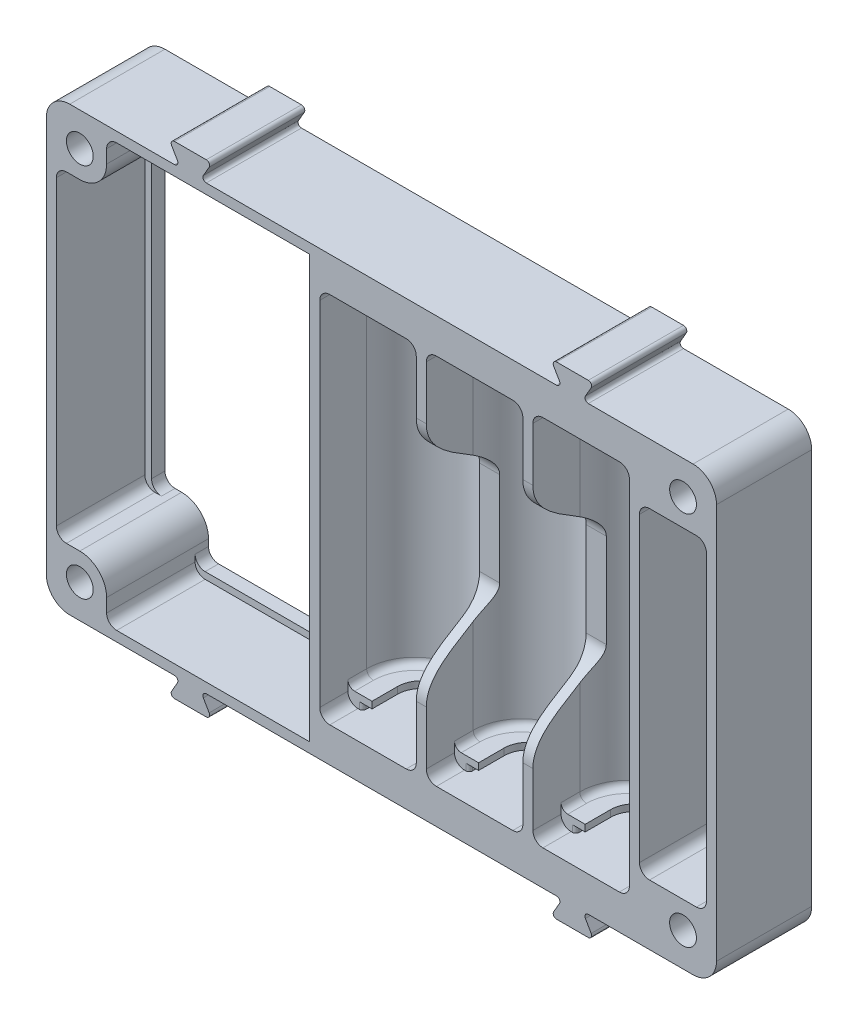
from build123d import *

# Parameters (mm, degrees)
BOSS_EXTRUDE1_DEPTH     = 27.8
SKETCH2_W               = 49.2
SKETCH2_H               = 15.2
BOSS_EXTRUDE2_DEPTH     = 1.5
CUT_EXTRUDE2_DEPTH      = 15
CUT_EXTRUDE2_DEPTH_BACK = 15
INNER_DEPTH             = 1
BOSS_EXTRUDE4_DEPTH     = 1
SKETCH5_W               = 3.4
SKETCH5_H               = 0.5
CUT_EXTRUDE1_DEPTH      = 42.166612686
SKETCH10_W              = 3.4
SKETCH10_H              = 2
CUT_EXTRUDE6_DEPTH      = 0.6
FILLET2_R               = 1.5
FILLET3_R               = 1
SKETCH_1_W              = 100
SKETCH_1_H              = 66
EXTRUDE_1_DEPTH         = 15.2
SKETCH_2_W              = 49.2
SKETCH_2_H              = 1
SKETCH_2_W_2            = 30.3
SKETCH_2_W_3            = 1
SKETCH_2_H_2            = 48
EXTRUDE_2_DEPTH         = 2
FILLET_6_R              = 3.5
CUT_EXTRUDE_START       = -1
CUT_EXTRUDE_1_DEPTH     = 1
FILLET_7_R              = 1.5
EXTRUDE_3_DEPTH         = 14.2
FILLET_8_R              = 0.5
FILLET_9_R              = 1.5
SKETCH_12_R             = 2
CUT_EXTRUDE_2_DEPTH     = 4.2
CUT_EXTRUDE_START_2     = -4.2
SKETCH_3_R              = 2
CUT_EXTRUDE_3_DEPTH     = 4.2
FILLET_10_R             = 4


with BuildPart() as part:
    # Sketch1 → Boss-Extrude1 (new body)
    with BuildSketch(Plane(origin=(0, 0, 0), x_dir=(1, 0, 0), z_dir=(0, 1, 0))):
        with BuildLine():
            Line((-24.6, 0), (24.6, 0))
            Line((24.6, 0), (24.6, -15.2))
            Line((24.6, -15.2), (23.1, -15.2))
            Line((23.1, -15.2), (23.1, -8.2))
            ThreePointArc((23.1, -8.2), (15.9, -1), (8.7, -8.2))
            Line((8.7, -8.2), (8.7, -15.2))
            Line((8.7, -15.2), (7.2, -15.2))
            Line((7.2, -15.2), (7.2, -8.2))
            ThreePointArc((7.2, -8.2), (0, -1), (-7.2, -8.2))
            Line((-7.2, -8.2), (-7.2, -15.2))
            Line((-7.2, -15.2), (-8.7, -15.2))
            Line((-8.7, -15.2), (-8.7, -8.2))
            ThreePointArc((-8.7, -8.2), (-15.9, -1), (-23.1, -8.2))
            Line((-23.1, -8.2), (-23.1, -15.2))
            Line((-23.1, -15.2), (-24.6, -15.2))
            Line((-24.6, -15.2), (-24.6, 0))
        make_face()
    extrude(amount=BOSS_EXTRUDE1_DEPTH)

    # Sketch2 → Boss-Extrude2 (add)
    with BuildSketch(Plane.XZ.offset(-27.8)):
        with Locations((0, 7.6)):
            Rectangle(SKETCH2_W, SKETCH2_H)
    extrude(amount=-BOSS_EXTRUDE2_DEPTH)

    # Sketch6 → Cut-Extrude2 (cut, two sides: drawn at the far end of the back side and taken through both)
    with BuildSketch(Plane(origin=(0, 0, 0), x_dir=(0, 0, -1), z_dir=(1, 0, 0)).offset(-CUT_EXTRUDE2_DEPTH_BACK)):
        with BuildLine():
            Line((-5, 0), (-15.2, 0))
            Line((-15.2, 0), (-15.2, 18.3))
            add(Edge.make_bspline(
                [(-15.2, 18.3), (-15.2, 12.3), (-5, 11), (-5, 7)],
                knots=[0, 0, 0, 0, 1, 1, 1, 1], degree=3))
            Line((-5, 7), (-5, 0))
        make_face()
    extrude(amount=CUT_EXTRUDE2_DEPTH + CUT_EXTRUDE2_DEPTH_BACK, mode=Mode.SUBTRACT)

    # Sketch3 → Inner (add)
    with BuildSketch(Plane.XZ.offset(-27.8)):
        with BuildLine():
            Line((-10.4, 11), (-8.7, 11))
            Line((-8.7, 11), (-8.7, 0))
            Line((-8.7, 0), (-23.1, 0))
            Line((-23.1, 0), (-23.1, 11))
            Line((-23.1, 11), (-21.4, 11))
            ThreePointArc((-21.4, 11), (-21.046446609, 10.853553391), (-20.9, 10.5))
            Line((-20.9, 10.5), (-20.9, 3.4))
            ThreePointArc((-20.9, 3.4), (-20.753553391, 3.046446609), (-20.4, 2.9))
            Line((-20.4, 2.9), (-11.4, 2.9))
            ThreePointArc((-11.4, 2.9), (-11.046446609, 3.046446609), (-10.9, 3.4))
            Line((-10.9, 3.4), (-10.9, 10.5))
            ThreePointArc((-10.9, 10.5), (-10.753553391, 10.853553391), (-10.4, 11))
        make_face()
    inner = extrude(amount=INNER_DEPTH)

    # Sketch4 → Boss-Extrude4 (add)
    with BuildSketch(Plane.XZ.offset(-26.8)):
        with BuildLine():
            Line((-8.7, 11), (-8.7, 0))
            Line((-8.7, 0), (-23.1, 0))
            Line((-23.1, 0), (-23.1, 11))
            Line((-23.1, 11), (-19.5, 11))
            Line((-19.5, 11), (-19.5, 7.2))
            ThreePointArc((-19.5, 7.2), (-15.9, 3.6), (-12.3, 7.2))
            Line((-12.3, 7.2), (-12.3, 11))
            Line((-12.3, 11), (-8.7, 11))
        make_face()
    boss_extrude4 = extrude(amount=BOSS_EXTRUDE4_DEPTH)

    # Sketch5 → Cut-Extrude1 (cut, through all)
    with BuildSketch(Plane.XY.offset(15.2)):
        with Locations((-15.9, 27.55)):
            Rectangle(SKETCH5_W, SKETCH5_H)
    cut_extrude1 = extrude(amount=-CUT_EXTRUDE1_DEPTH, mode=Mode.SUBTRACT)

    # Sketch10 → Cut-Extrude6 (cut)
    with BuildSketch(Plane.XY):
        with Locations((-15.9, 28.3)):
            Rectangle(SKETCH10_W, SKETCH10_H)
    cut_extrude6 = extrude(amount=CUT_EXTRUDE6_DEPTH, mode=Mode.SUBTRACT)

    # Mirror1: Inner, Boss-Extrude4, Cut-Extrude1, Cut-Extrude6 across plane
    add(inner.mirror(Plane(origin=(0, 0, 0), x_dir=(0, 0, 1), z_dir=(1, 0, 0))))
    add(boss_extrude4.mirror(Plane(origin=(0, 0, 0), x_dir=(0, 0, 1), z_dir=(1, 0, 0))))
    add(cut_extrude1.mirror(Plane(origin=(0, 0, 0), x_dir=(0, 0, 1), z_dir=(1, 0, 0))), mode=Mode.SUBTRACT)
    add(cut_extrude6.mirror(Plane(origin=(0, 0, 0), x_dir=(0, 0, 1), z_dir=(1, 0, 0))), mode=Mode.SUBTRACT)

    # Mirror2: Inner, Boss-Extrude4, Cut-Extrude1, Cut-Extrude6 across plane
    add(inner.mirror(Plane(origin=(-7.95, 0, 0), x_dir=(0, 0, 1), z_dir=(1, 0, 0))))
    add(boss_extrude4.mirror(Plane(origin=(-7.95, 0, 0), x_dir=(0, 0, 1), z_dir=(1, 0, 0))))
    add(cut_extrude1.mirror(Plane(origin=(-7.95, 0, 0), x_dir=(0, 0, 1), z_dir=(1, 0, 0))), mode=Mode.SUBTRACT)
    add(cut_extrude6.mirror(Plane(origin=(-7.95, 0, 0), x_dir=(0, 0, 1), z_dir=(1, 0, 0))), mode=Mode.SUBTRACT)

    # Fillet2
    fillet2_edges = [part.edges().sort_by_distance(p)[0] for p in [
        (-8.7, 27.8, 13.1),
        (-23.1, 27.8, 13.1),
        (23.1, 27.8, 13.1),
        (-7.2, 27.8, 13.1),
        (7.2, 27.8, 13.1),
        (8.7, 27.8, 13.1),
    ]]
    fillet(fillet2_edges, radius=FILLET2_R)

    # Fillet3
    fillet3_edges = [part.edges().sort_by_distance(p)[0] for p in [
        (-8.7, 25.8, 9.6),
        (-23.1, 25.8, 9.6),
        (-15.9, 25.8, 1),
        (8.7, 25.8, 9.6),
        (23.1, 25.8, 9.6),
        (15.9, 25.8, 1),
        (-7.2, 25.8, 9.6),
        (7.2, 25.8, 9.6),
        (0, 25.8, 1),
    ]]
    fillet(fillet3_edges, radius=FILLET3_R)

    # Mirror4: part across plane


with BuildPart() as part_1:
    add(part.part)
    add(part.part.mirror(Plane.ZX))

    # Эскиз1 → Бобышка-Вытянуть1 (add)
    with BuildSketch(Plane(origin=(0, 0, 0), x_dir=(-1, 0, 0), z_dir=(0, 0, -1))):
        with Locations((13.9, 0)):
            Rectangle(SKETCH_1_W, SKETCH_1_H)
        Polygon((-24.6, -29.3), (-24.6, -24), (-34.6, -24), (-34.6, 24), (-24.6, 24), (-24.6, 29.3), (24.6, 29.3), (24.6, 31.5), (54.9, 31.5), (54.9, 24), (62.4, 24), (62.4, -24), (54.9, -24), (54.9, -31.5), (24.6, -31.5), (24.6, -29.3), align=None, mode=Mode.SUBTRACT)
    extrude(amount=-EXTRUDE_1_DEPTH)

    # Эскиз2 → Бобышка-Вытянуть2 (add)
    with BuildSketch(Plane(origin=(0, 0, 0), x_dir=(-1, 0, 0), z_dir=(0, 0, -1))):
        Polygon((-34.6, 31.5), (-34.6, 24), (-33.6, 24), (-24.6, 24), (-24.6, 30.5), (-24.6, 31.5), align=None)
        with Locations((0, 31)):
            Rectangle(SKETCH_2_W, SKETCH_2_H)
        with Locations((39.75, 31)):
            Rectangle(SKETCH_2_W_2, SKETCH_2_H)
        Polygon((54.9, 31.5), (54.9, 30.5), (54.9, 24), (61.4, 24), (62.4, 24), (62.4, 31.5), align=None)
        with Locations((61.9, 0)):
            Rectangle(SKETCH_2_W_3, SKETCH_2_H_2)
        Polygon((54.9, -30.5), (54.9, -31.5), (62.4, -31.5), (62.4, -24), (61.4, -24), (54.9, -24), align=None)
        with Locations((39.75, -31)):
            Rectangle(SKETCH_2_W_2, SKETCH_2_H)
        with Locations((0, -31)):
            Rectangle(SKETCH_2_W, SKETCH_2_H)
        Polygon((-34.6, -24), (-34.6, -31.5), (-24.6, -31.5), (-24.6, -30.5), (-24.6, -24), (-33.6, -24), align=None)
        with Locations((-34.1, 0)):
            Rectangle(SKETCH_2_W_3, SKETCH_2_H_2)
    extrude(amount=-EXTRUDE_2_DEPTH)

    # Скругление6
    fillet_6_edges = [part_1.edges().sort_by_distance(p)[0] for p in [
        (-63.9, 33, 7.6),
        (36.1, 33, 7.6),
        (36.1, -33, 7.6),
        (-63.9, -33, 7.6),
    ]]
    fillet(fillet_6_edges, radius=FILLET_6_R)

    # Эскиз8 → Вырез-Вытянуть1 (cut)
    with BuildSketch(Plane(origin=(0, 0, 0), x_dir=(-1, 0, 0), z_dir=(0, 0, -1)).offset(CUT_EXTRUDE_START)):
        with BuildLine():
            Line((63.9, -29.5), (63.9, 29.5))
            ThreePointArc((63.9, 29.5), (62.874873734, 31.974873734), (60.4, 33))
            Line((60.4, 33), (-32.6, 33))
            ThreePointArc((-32.6, 33), (-35.074873734, 31.974873734), (-36.1, 29.5))
            Line((-36.1, 29.5), (-36.1, -29.5))
            ThreePointArc((-36.1, -29.5), (-35.074873734, -31.974873734), (-32.6, -33))
            Line((-32.6, -33), (60.4, -33))
            ThreePointArc((60.4, -33), (62.874873734, -31.974873734), (63.9, -29.5))
        make_face()
        with BuildLine():
            Line((62.4, -29.5), (62.4, 29.5))
            ThreePointArc((62.4, 29.5), (61.814213562, 30.914213562), (60.4, 31.5))
            Line((60.4, 31.5), (-32.6, 31.5))
            ThreePointArc((-32.6, 31.5), (-34.014213562, 30.914213562), (-34.6, 29.5))
            Line((-34.6, 29.5), (-34.6, -29.5))
            ThreePointArc((-34.6, -29.5), (-34.014213562, -30.914213562), (-32.6, -31.5))
            Line((-32.6, -31.5), (60.4, -31.5))
            ThreePointArc((60.4, -31.5), (61.814213562, -30.914213562), (62.4, -29.5))
        make_face(mode=Mode.SUBTRACT)
    extrude(amount=CUT_EXTRUDE_1_DEPTH, mode=Mode.SUBTRACT)

    # Скругление7
    fillet_7_edges = [part_1.edges().sort_by_distance(p)[0] for p in [
        (24.6, -24, 7.6),
        (24.6, 24, 7.6),
        (-54.9, 30.5, 1),
        (-24.6, -30.5, 1),
        (-61.4, -24, 1),
        (-61.4, 24, 1),
        (-24.6, 30.5, 1),
        (33.6, 24, 1),
        (33.6, -24, 1),
        (-54.9, -30.5, 1),
    ]]
    fillet(fillet_7_edges, radius=FILLET_7_R)

    # Эскиз11 → Бобышка-Вытянуть3 (add)
    with BuildSketch(Plane.XY.offset(15.2)):
        Polygon((-43.9, 33), (-45.632050808, 36), (-39.167949192, 36), (-40.9, 33), align=None)
        Polygon((13.1, 33), (11.367949192, 36), (17.832050808, 36), (16.1, 33), align=None)
        Polygon((-43.9, -33), (-45.632050808, -36), (-39.167949192, -36), (-40.9, -33), align=None)
        Polygon((13.1, -33), (11.367949192, -36), (17.832050808, -36), (16.1, -33), align=None)
    extrude(amount=-EXTRUDE_3_DEPTH)

    # Скругление8
    fillet_8_edges = [part_1.edges().sort_by_distance(p)[0] for p in [
        (-39.167949192, 36, 8.1),
        (-45.632050808, 36, 8.1),
        (-43.9, 33, 8.1),
        (-40.9, 33, 8.1),
        (17.832050808, 36, 8.1),
        (11.367949192, 36, 8.1),
        (13.1, 33, 8.1),
        (16.1, 33, 8.1),
        (11.367949192, -36, 8.1),
        (17.832050808, -36, 8.1),
        (16.1, -33, 8.1),
        (13.1, -33, 8.1),
        (-43.9, -33, 8.1),
        (-45.632050808, -36, 8.1),
        (-39.167949192, -36, 8.1),
        (-40.9, -33, 8.1),
    ]]
    fillet(fillet_8_edges, radius=FILLET_8_R)

    # Скругление9
    fillet_9_edges = [part_1.edges().sort_by_distance(p)[0] for p in [
        (-54.9, 31.5, 8.6),
        (-62.4, 24, 8.6),
        (-62.4, -24, 8.6),
        (-54.9, -31.5, 8.6),
        (34.6, -24, 8.6),
        (34.6, 24, 8.6),
    ]]
    fillet(fillet_9_edges, radius=FILLET_9_R)

    # Эскиз12 → Вырез-Вытянуть2 (cut)
    with BuildSketch(Plane(origin=(0, 0, 0), x_dir=(-1, 0, 0), z_dir=(0, 0, -1))):
        with Locations((-31.1, 28)):
            Circle(SKETCH_12_R)
        with Locations((58.9, 28)):
            Circle(SKETCH_12_R)
        with Locations((58.9, -28)):
            Circle(SKETCH_12_R)
        with Locations((-31.1, -28)):
            Circle(SKETCH_12_R)
    extrude(amount=-CUT_EXTRUDE_2_DEPTH, mode=Mode.SUBTRACT)

    # Эскиз3 → Вырез-Вытянуть3 (cut)
    with BuildSketch(Plane.XY.offset(15.2).offset(CUT_EXTRUDE_START_2)):
        with Locations(Location((-58.9, 28, 0), (0, 0, 180))):
            Circle(SKETCH_3_R)
        with Locations(Location((31.1, 28, 0), (0, 0, 180))):
            Circle(SKETCH_3_R)
        with Locations(Location((31.1, -28, 0), (0, 0, 180))):
            Circle(SKETCH_3_R)
        with Locations(Location((-58.9, -28, 0), (0, 0, 180))):
            Circle(SKETCH_3_R)
    extrude(amount=CUT_EXTRUDE_3_DEPTH, mode=Mode.SUBTRACT)

    # Скругление10
    fillet_10_edges = [part_1.edges().sort_by_distance(p)[0] for p in [
        (-54.9, 24, 7.6),
        (-54.9, -24, 7.6),
    ]]
    fillet(fillet_10_edges, radius=FILLET_10_R)


solid = part_1.part
